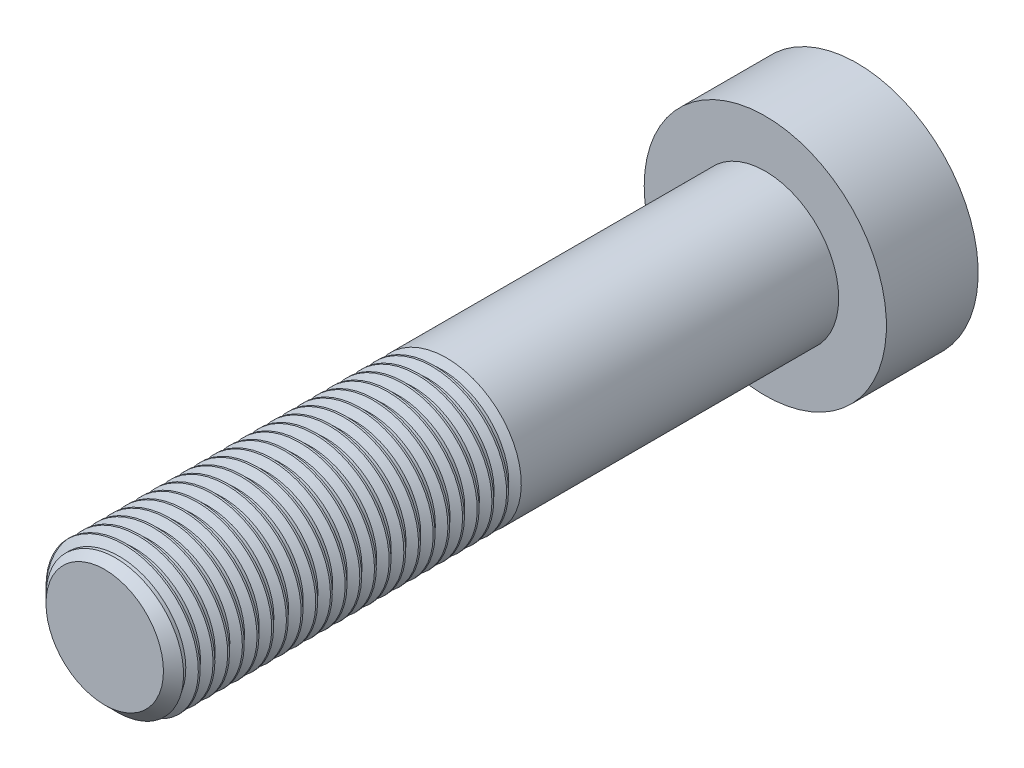
from build123d import *

# Parameters (mm, degrees)
SKETCH_1_R      = 10
EXTRUDE_1_DEPTH = 90
SKETCH_2_R      = 16.5
EXTRUDE_2_DEPTH = 12.5
CHAMFER_1_SIZE  = 2
THREAD_1_PITCH  = 2


with BuildPart() as part:
    # Sketch 1 → Бобышка-Вытянуть1 (new body)
    with BuildSketch(Plane.XY):
        with Locations(Location((0, 0, 0), (0, 0, 180))):
            Circle(SKETCH_1_R)
    extrude(amount=EXTRUDE_1_DEPTH)

    # Эскиз2 → Бобышка-Вытянуть2 (add)
    with BuildSketch(Plane(origin=(0, 0, 0), x_dir=(-1, 0, 0), z_dir=(0, 0, -1))):
        Circle(SKETCH_2_R)
    extrude(amount=EXTRUDE_2_DEPTH)

    # Фаска1
    chamfer_1_edges = [part.edges().sort_by_distance(p)[0] for p in [
        (10, 0, 90),
    ]]
    chamfer(chamfer_1_edges, length=CHAMFER_1_SIZE)

    # Резьба1: the profile of Sketch 1 2 profile screwed along a right-hand helix of 23 turns, 10 arcs to a turn; built about Z, then put on its axis
    thread_1_z = Axis((0, 0, 0), (0, 0, 1))
    thread_1_corners = [(10.0003, 0, -0.000173205), (10.0003, 0, 1.7501732), (8.91746825, 0, 1.124999997), (8.91746825, 0, 0.624999997)]
    with BuildLine(mode=Mode.PRIVATE) as thread_1_profile:
        Line(thread_1_corners[0], thread_1_corners[1])
        Line(thread_1_corners[1], thread_1_corners[2])
        Line(thread_1_corners[2], thread_1_corners[3])
        Line(thread_1_corners[3], thread_1_corners[0])
    thread_1_cap = Face(thread_1_profile.wire())
    thread_1_turn_angles = [0, 18, 36, 54, 72, 90, 108, 126, 144, 162, 180, 198, 216, 234, 252, 270, 288, 306, 324, 342, 360]
    thread_1_turn_weights = [1, 0.9510565162951535, 1, 0.9510565162951535, 1, 0.9510565162951535, 1, 0.9510565162951535, 1, 0.9510565162951535, 1, 0.9510565162951535, 1, 0.9510565162951535, 1, 0.9510565162951535, 1, 0.9510565162951535, 1, 0.9510565162951535, 1]
    thread_1_turn_rails = [Edge.make_bspline([Vector(p[0], p[1], 0).rotate(thread_1_z, thread_1_turn_angles[k]) / thread_1_turn_weights[k] + Vector(0, 0, p[2] + THREAD_1_PITCH * thread_1_turn_angles[k] / 360) for k in range(21)], [0, 0, 0, 1, 1, 2, 2, 3, 3, 4, 4, 5, 5, 6, 6, 7, 7, 8, 8, 9, 9, 10, 10, 10], 2, thread_1_turn_weights) for p in thread_1_corners]
    thread_1_turn_sides = [Face.make_surface_from_curves(thread_1_turn_rails[p[0]], thread_1_turn_rails[p[1]]) for p in [(0, 1), (1, 2), (2, 3), (3, 0)]]
    thread_1 = Plane(origin=(0, 0, 90), x_dir=(-1, 0, 0), z_dir=(0, 0, -1)) * Solid(Shell([*[p.moved(Location((0, 0, THREAD_1_PITCH * i))) for i in range(23) for p in thread_1_turn_sides], thread_1_cap, thread_1_cap.rotate(thread_1_z, 8280).moved(Location((0, 0, THREAD_1_PITCH * 8280 / 360)))]))
    add(thread_1, mode=Mode.SUBTRACT)


solid = part.part
